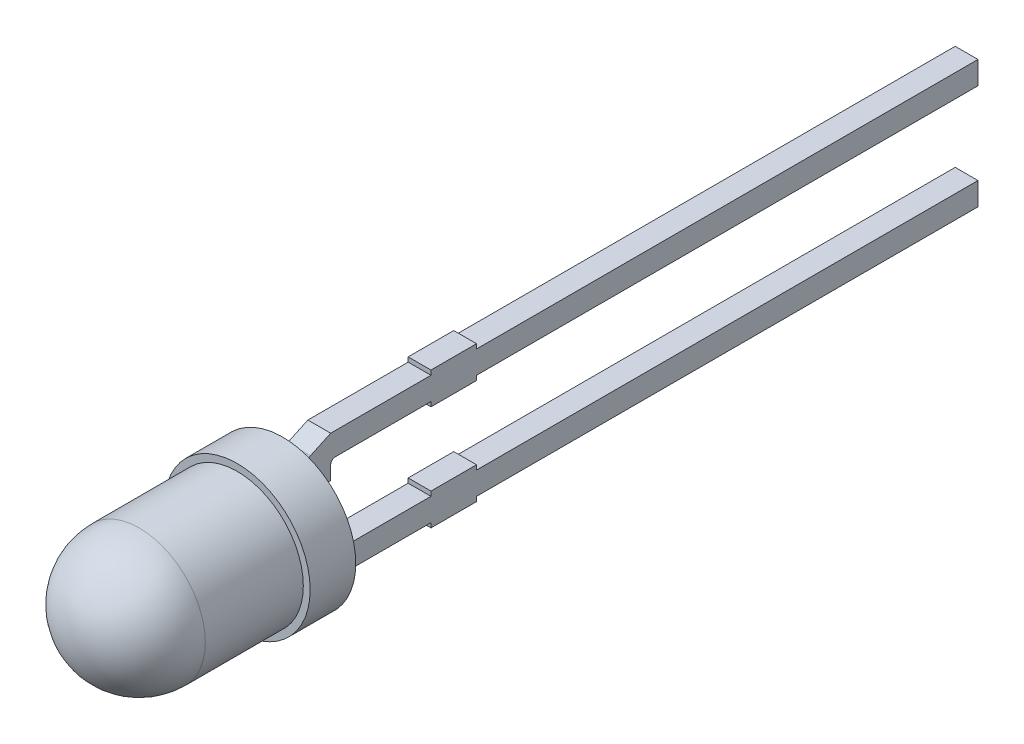
from build123d import *

# Parameters (mm, degrees)
EXTRUDE1_DEPTH          = 0.25
FILLET1_R               = 0.25
CUT_EXTRUDE1_DEPTH      = 31.234789562
CUT_EXTRUDE1_DEPTH_BACK = 31.234789562
SKETCH3_W               = 12.882415547
SKETCH3_H               = 2.8


with BuildPart() as part:
    # Sketch1 → Revolve1 (revolve)
    with BuildSketch(Plane(origin=(0, 0, 0), x_dir=(0, 0, -1), z_dir=(1, 0, 0))):
        with BuildLine():
            Line((0, 1.45), (2.15, 1.45))
            Line((2.15, 1.45), (2.15, 1.599999975))
            Line((2.15, 1.599999975), (3.15, 1.599999975))
            Line((3.15, 1.599999975), (3.15, 0))
            Line((3.15, 0), (-1.45, 0))
            ThreePointArc((-1.45, 0), (-1.025304833, 1.025304833), (0, 1.45))
        make_face()
    revolve(axis=Axis((0, 0, 0), (0, 0, -1)))

    # Sketch2 → Extrude1 (add, symmetric)
    with BuildSketch(Plane(origin=(0, 0, 0), x_dir=(0, 0, -1), z_dir=(1, 0, 0))):
        with BuildLine():
            Line((3.15, 1.026953873), (3.95, 1.4))
            Line((3.95, 1.4), (6.15, 1.4))
            Line((6.15, 1.4), (6.15, 1.5))
            Line((6.15, 1.5), (7.15, 1.5))
            Line((7.15, 1.5), (7.15, 1.4))
            Line((7.15, 1.4), (30.15, 1.4))
            Line((30.15, 1.4), (30.15, 0.9))
            Line((30.15, 0.9), (7.15, 0.9))
            Line((7.15, 0.9), (7.15, 0.8))
            Line((7.15, 0.8), (6.15, 0.8))
            Line((6.15, 0.8), (6.15, 0.9))
            Line((6.15, 0.9), (4.05, 0.9))
            ThreePointArc((4.05, 0.9), (3.979289322, 0.870710678), (3.95, 0.8))
            Line((3.95, 0.8), (3.95, 0.5))
            Line((3.95, 0.5), (3.15, 0.5))
            Line((3.15, 0.5), (3.15, 1.026953873))
        make_face()
        with BuildLine():
            Line((3.95, -0.8), (3.95, -0.5))
            Line((3.95, -0.5), (3.15, -0.5))
            Line((3.15, -0.5), (3.15, -1.026953873))
            Line((3.15, -1.026953873), (3.95, -1.4))
            Line((3.95, -1.4), (6.15, -1.4))
            Line((6.15, -1.4), (6.15, -1.5))
            Line((6.15, -1.5), (7.15, -1.5))
            Line((7.15, -1.5), (7.15, -1.4))
            Line((7.15, -1.4), (30.15, -1.4))
            Line((30.15, -1.4), (30.15, -0.9))
            Line((30.15, -0.9), (7.15, -0.9))
            Line((7.15, -0.9), (7.15, -0.8))
            Line((7.15, -0.8), (6.15, -0.8))
            Line((6.15, -0.8), (6.15, -0.9))
            Line((6.15, -0.9), (4.05, -0.9))
            ThreePointArc((4.05, -0.9), (3.979289322, -0.870710678), (3.95, -0.8))
        make_face()
    extrude(amount=EXTRUDE1_DEPTH, both=True)

    # Fillet1
    fillet1_edges = [part.edges().sort_by_distance(p)[0] for p in [
        (0, -0.5, -3.15),
        (0, -1.026953873, -3.15),
        (-0.25, -0.763476937, -3.15),
        (0, 0.5, -3.15),
        (-0.25, 0.763476937, -3.15),
        (0, 1.026953873, -3.15),
        (0.25, 0.763476937, -3.15),
        (0.25, -0.763476937, -3.15),
    ]]
    fillet(fillet1_edges, radius=FILLET1_R)

    # Sketch3 → Cut-Extrude1 (cut, two sides: drawn at the far end of the back side and taken through both)
    with BuildSketch(Plane(origin=(0, 0, 0), x_dir=(0, 0, -1), z_dir=(1, 0, 0)).offset(-CUT_EXTRUDE1_DEPTH_BACK)):
        with Locations((24.591207774, 0)):
            Rectangle(SKETCH3_W, SKETCH3_H)
    extrude(amount=CUT_EXTRUDE1_DEPTH + CUT_EXTRUDE1_DEPTH_BACK, mode=Mode.SUBTRACT)


solid = part.part
